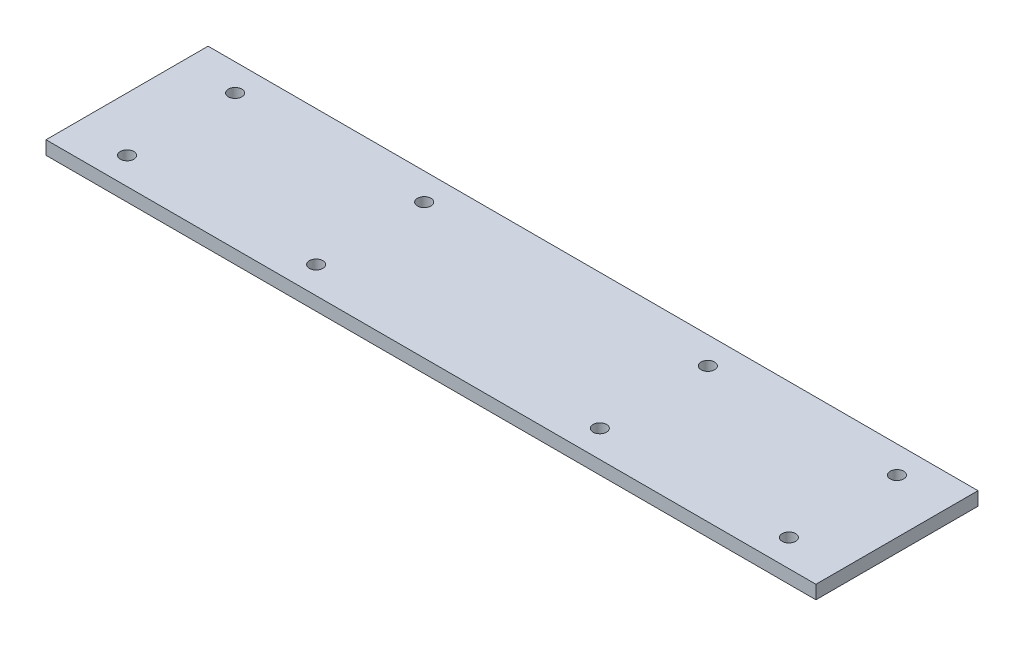
from build123d import *

# Parameters (mm, degrees)
SKETCH1_W           = 723.9
SKETCH1_H           = 152.4
BOSS_EXTRUDE1_DEPTH = 12.7
SKETCH2_R           = 6.35
CUT_EXTRUDE1_DEPTH  = 455.784476325


with BuildPart() as part:
    # Sketch1 → Boss-Extrude1 (new body)
    with BuildSketch(Plane(origin=(0, 0, 0), x_dir=(1, 0, 0), z_dir=(0, 1, 0))):
        with Locations((66.351143947, 76.2)):
            Rectangle(SKETCH1_W, SKETCH1_H)
    extrude(amount=BOSS_EXTRUDE1_DEPTH)

    # Sketch2 → Cut-Extrude1 (cut, through all)
    with BuildSketch(Plane(origin=(0, 12.7, 0), x_dir=(1, 0, 0), z_dir=(0, 1, 0))):
        with Locations((377.501143947, 127)):
            Circle(SKETCH2_R)
        with Locations((377.501143947, 25.4)):
            Circle(SKETCH2_R)
        with Locations((199.701143947, 127)):
            Circle(SKETCH2_R)
        with Locations((199.701143947, 25.4)):
            Circle(SKETCH2_R)
        with Locations((-244.798856053, 127)):
            Circle(SKETCH2_R)
        with Locations((-66.998856053, 127)):
            Circle(SKETCH2_R)
        with Locations((-244.798856053, 25.4)):
            Circle(SKETCH2_R)
        with Locations((-66.998856053, 25.4)):
            Circle(SKETCH2_R)
    extrude(amount=-CUT_EXTRUDE1_DEPTH, mode=Mode.SUBTRACT)


solid = part.part
